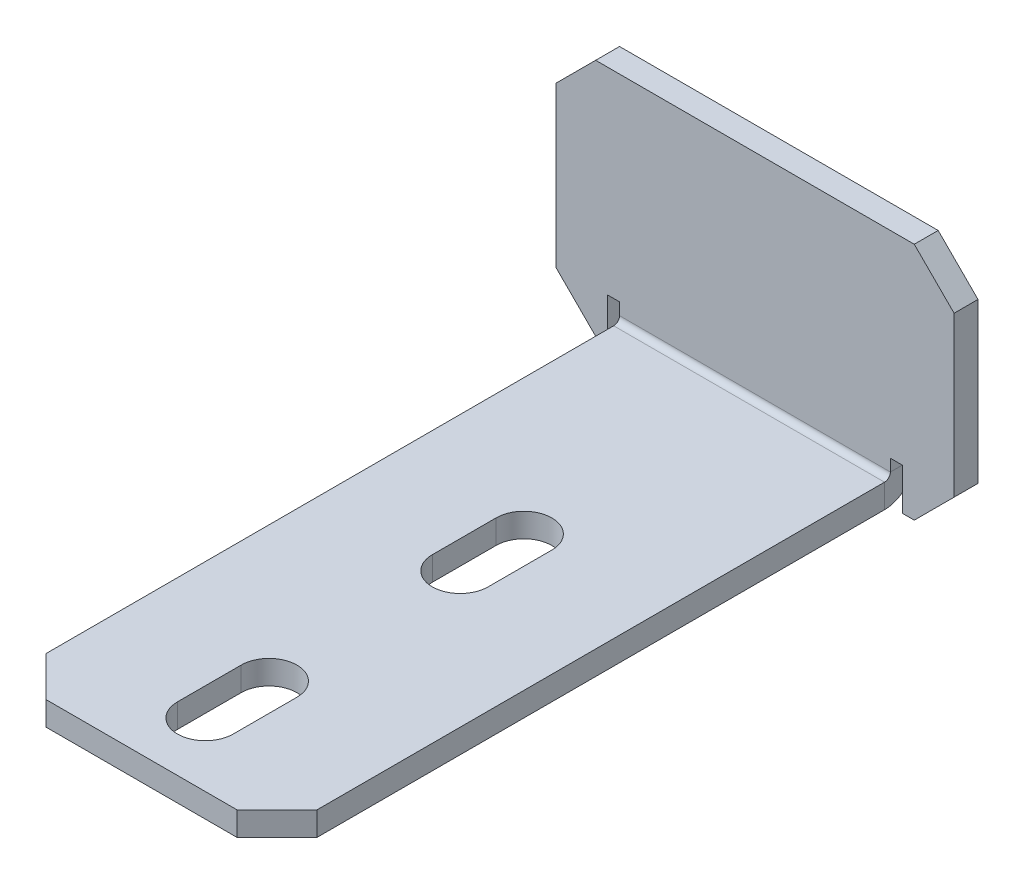
from build123d import *

# Parameters (mm, degrees)
SKETCH_1_W                        = 50
SKETCH_1_H                        = 30
SM_BASE_FLANGE_1_DEPTH            = 3
SM_EDGE_FLANGE_1_STRIP_W          = 13.4732
SM_EDGE_FLANGE_1_STRIP_H          = 3
SM_EDGE_FLANGE_1_STRIP_CUT_DEPTH  = 34
SM_EDGE_FLANGE_1_RELIEF_W         = 14.9732
SM_EDGE_FLANGE_1_RELIEF_H         = 1.5
SM_EDGE_FLANGE_1_RELIEF_CUT_DEPTH = 3
SM_EDGE_FLANGE_1_DEPTH            = 34
CHAMFER_1_SIZE                    = 5
CUT_EXTRUDE_1_DEPTH               = 10


# Sheet-metal steps are written as plain solids
with BuildPart() as part:
    # Sketch 1 → 基体-法兰1 (new body)
    with BuildSketch(Plane.XY):
        with Locations((25, 15)):
            Rectangle(SKETCH_1_W, SKETCH_1_H)
    extrude(amount=-SM_BASE_FLANGE_1_DEPTH)

    # 边线-法兰1 strip (across the edge) → 边线-法兰1 strip cut (cut)
    with BuildSketch(Plane.YZ.offset(8)):
        with Locations((-3, -1.5)):
            Rectangle(SM_EDGE_FLANGE_1_STRIP_W, SM_EDGE_FLANGE_1_STRIP_H)
    extrude(amount=SM_EDGE_FLANGE_1_STRIP_CUT_DEPTH, mode=Mode.SUBTRACT)

    # 边线-法兰1 relief (on the sheet) → 边线-法兰1 relief cut (cut)
    with BuildSketch(Plane(origin=(8, 3.7366, 0), x_dir=(0, 1, 0), z_dir=(0, 0, 1))):
        with Locations((-5.9866, 0.75)):
            Rectangle(SM_EDGE_FLANGE_1_RELIEF_W, SM_EDGE_FLANGE_1_RELIEF_H)
        with Locations((-5.9866, -34.75)):
            Rectangle(SM_EDGE_FLANGE_1_RELIEF_W, SM_EDGE_FLANGE_1_RELIEF_H)
    extrude(amount=-SM_EDGE_FLANGE_1_RELIEF_CUT_DEPTH, mode=Mode.SUBTRACT)

    # 边线-法兰1 section (across the edge) → 边线-法兰1 (add)
    with BuildSketch(Plane.YZ.offset(8)):
        with BuildLine():
            Line((0, 0.7366), (0, 77))
            Line((0, 77), (3, 77))
            Line((3, 77), (3, 0.7366))
            ThreePointArc((3, 0.7366), (3.215745145, 0.215745145), (3.7366, 0))
            Line((3.7366, 0), (3.7366, -3))
            ThreePointArc((3.7366, -3), (1.094424801, -1.905575199), (0, 0.7366))
        make_face()
    extrude(amount=SM_EDGE_FLANGE_1_DEPTH)

    # 倒角1
    chamfer_1_edges = [part.edges().sort_by_distance(p)[0] for p in [
        (8, 1.5, 77),
        (42, 1.5, 77),
        (0, 30, -1.5),
        (50, 30, -1.5),
        (50, 0, -1.5),
        (0, 0, -1.5),
    ]]
    chamfer(chamfer_1_edges, length=CHAMFER_1_SIZE)

    # 草图9 → 切除-拉伸1 (cut)
    with BuildSketch(Plane(origin=(0, 3, 0), x_dir=(1, 0, 0), z_dir=(0, 1, 0))):
        with BuildLine():
            Line((28.5, -29), (28.5, -37))
            ThreePointArc((28.5, -37), (25, -40.5), (21.5, -37))
            Line((21.5, -37), (21.5, -29))
            ThreePointArc((21.5, -29), (25, -25.5), (28.5, -29))
        make_face()
        with BuildLine():
            Line((21.5, -69), (21.5, -61))
            ThreePointArc((21.5, -61), (25, -57.5), (28.5, -61))
            Line((28.5, -61), (28.5, -69))
            ThreePointArc((28.5, -69), (25, -72.5), (21.5, -69))
        make_face()
    extrude(amount=-CUT_EXTRUDE_1_DEPTH, mode=Mode.SUBTRACT)


solid = part.part
